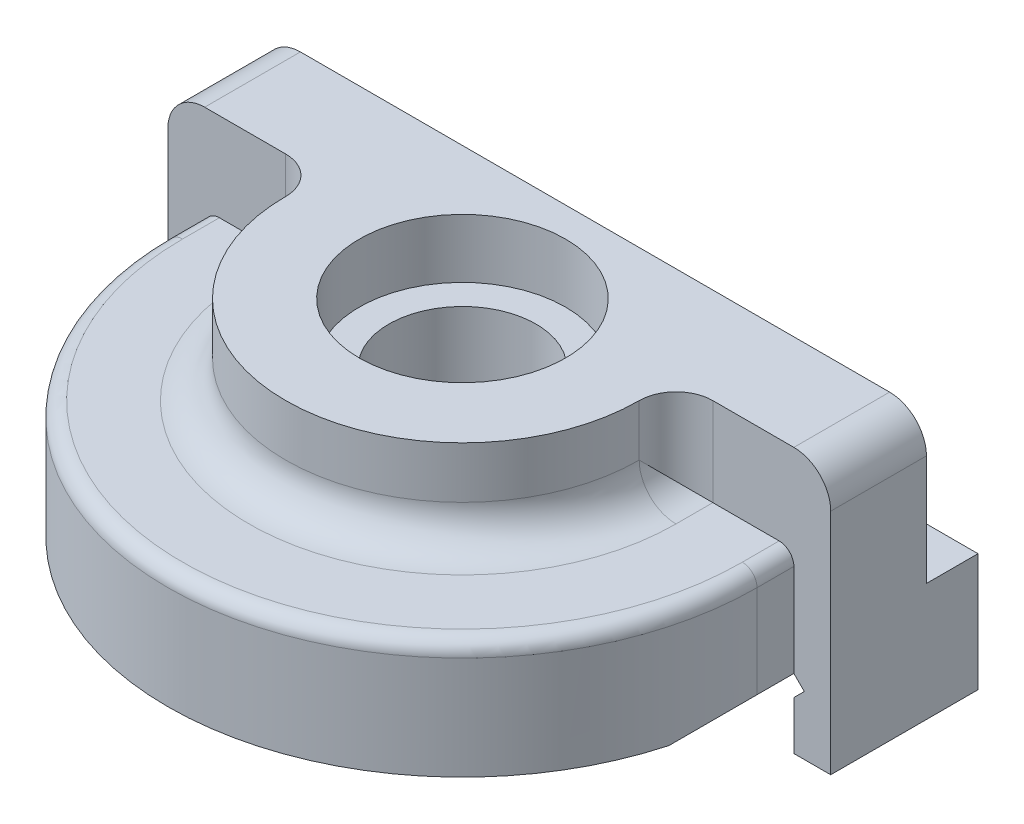
from build123d import *

# Parameters (mm, degrees)
EXTRUDE_1_DEPTH        = 16
EXTRUDE_2_DEPTH        = 12
EXTRUDE_3_DEPTH        = 20
CUT_EXTRUDE_START      = -7
CUT_EXTRUDE_1_DEPTH    = 7
SKETCH_6_R             = 10
CUT_EXTRUDE_2_DEPTH    = 71.149839629
SKETCH_7_R             = 14
CUT_EXTRUDE_3_DEPTH    = 8
HOLE_WIZARD_M8_1_D     = 6.8
HOLE_WIZARD_M8_1_DEPTH = 16.25
HOLE_WIZARD_M8_1_TIP   = 2.042926105
CUT_EXTRUDE_4_DEPTH    = 84.868945385
FILLET_3_R             = 2
FILLET_6_R             = 5


with BuildPart() as part:
    # 草图1 → 凸台-拉伸1 (new body)
    with BuildSketch(Plane(origin=(0, 0, 0), x_dir=(1, 0, 0), z_dir=(0, 1, 0))):
        with BuildLine():
            Line((40, 5), (-40, 5))
            Line((-40, 5), (-40, 0))
            ThreePointArc((-40, 0), (0, -40), (40, 0))
            Line((40, 0), (40, 5))
        make_face()
    extrude(amount=EXTRUDE_1_DEPTH)

    # 草图3 → 凸台-拉伸2 (add)
    with BuildSketch(Plane(origin=(0, 16, 0), x_dir=(1, 0, 0), z_dir=(0, 1, 0))):
        with BuildLine():
            Line((-24, 5), (-24, 0))
            ThreePointArc((-24, 0), (0, -24), (24, 0))
            Line((24, 0), (24, 5))
            Line((24, 5), (-24, 5))
        make_face()
    extrude(amount=EXTRUDE_2_DEPTH)

    # 草图4 → 凸台-拉伸3 (add)
    with BuildSketch(Plane(origin=(0, 0, -5), x_dir=(-1, 0, 0), z_dir=(0, 0, -1))):
        with BuildLine():
            Line((-45, 23), (-45, -8))
            Line((-45, -8), (-40, -8))
            Line((-40, -8), (-40, 0))
            Line((-40, 0), (40, 0))
            Line((40, 0), (40, -8))
            Line((40, -8), (45, -8))
            Line((45, -8), (45, 23))
            ThreePointArc((45, 23), (43.535533906, 26.535533906), (40, 28))
            Line((40, 28), (-40, 28))
            ThreePointArc((-40, 28), (-43.535533906, 26.535533906), (-45, 23))
        make_face()
    extrude(amount=EXTRUDE_3_DEPTH)

    # 草图5 → 切除-拉伸1 (cut)
    with BuildSketch(Plane(origin=(0, 0, -25), x_dir=(-1, 0, 0), z_dir=(0, 0, -1)).offset(CUT_EXTRUDE_START)):
        with BuildLine():
            Line((-45, 8), (45, 8))
            Line((45, 8), (45, 23))
            ThreePointArc((45, 23), (43.535533906, 26.535533906), (40, 28))
            Line((40, 28), (-40, 28))
            ThreePointArc((-40, 28), (-43.535533906, 26.535533906), (-45, 23))
            Line((-45, 23), (-45, 8))
        make_face()
    extrude(amount=CUT_EXTRUDE_1_DEPTH, mode=Mode.SUBTRACT)

    # 草图6 → 切除-拉伸2 (cut, through all)
    with BuildSketch(Plane(origin=(0, 28, 0), x_dir=(1, 0, 0), z_dir=(0, 1, 0))):
        with Locations(Location((0, 0, 0), (0, 0, 270))):
            Circle(SKETCH_6_R)
    extrude(amount=-CUT_EXTRUDE_2_DEPTH, mode=Mode.SUBTRACT)

    # 草图7 → 切除-拉伸3 (cut)
    with BuildSketch(Plane(origin=(0, 28, 0), x_dir=(1, 0, 0), z_dir=(0, 1, 0))):
        with Locations(Location((0, 0, 0), (0, 0, 270))):
            Circle(SKETCH_7_R)
    extrude(amount=-CUT_EXTRUDE_3_DEPTH, mode=Mode.SUBTRACT)

    # M8 螺纹孔1
    with Locations(Plane(origin=(0, 0, -18), x_dir=(-1, 0, 0), z_dir=(0, 0, -1))):
        with Locations((-20, 19), (20, 19)):
            Hole(HOLE_WIZARD_M8_1_D / 2, depth=HOLE_WIZARD_M8_1_DEPTH)
            with Locations((0, 0, -(HOLE_WIZARD_M8_1_DEPTH + HOLE_WIZARD_M8_1_TIP / 2))):  # 118° drill point
                Cone(0, HOLE_WIZARD_M8_1_D / 2, HOLE_WIZARD_M8_1_TIP, mode=Mode.SUBTRACT)

    # 草图12 → 切除-拉伸4 (cut, through all)
    with BuildSketch(Plane(origin=(0, 0, -25), x_dir=(-1, 0, 0), z_dir=(0, 0, -1))):
        Polygon((-38.585786438, 0), (-40, 1.414213562), (-41.414213562, 0), (-40, -1.414213562), (-40, 0), align=None)
    cut_extrude_4 = extrude(amount=-CUT_EXTRUDE_4_DEPTH, mode=Mode.SUBTRACT)

    # 镜向1: 切除-拉伸4 across plane
    add(cut_extrude_4.mirror(Plane(origin=(0, 0, 0), x_dir=(0, 0, 1), z_dir=(1, 0, 0))), mode=Mode.SUBTRACT)

    # 圆角3
    fillet_3_edges = [part.edges().sort_by_distance(p)[0] for p in [
        (40, 16, -2.5),
        (0, 16, 40),
        (-40, 16, -2.5),
    ]]
    fillet(fillet_3_edges, radius=FILLET_3_R)

    # 圆角6
    fillet_6_edges = [part.edges().sort_by_distance(p)[0] for p in [
        (-24, 16, -2.5),
        (24, 16, -2.5),
        (-24, 22, -5),
        (24, 22, -5),
        (0, 16, 24),
    ]]
    fillet(fillet_6_edges, radius=FILLET_6_R - 0.0001)  # a hair under: the kernel refuses the full size


solid = part.part
